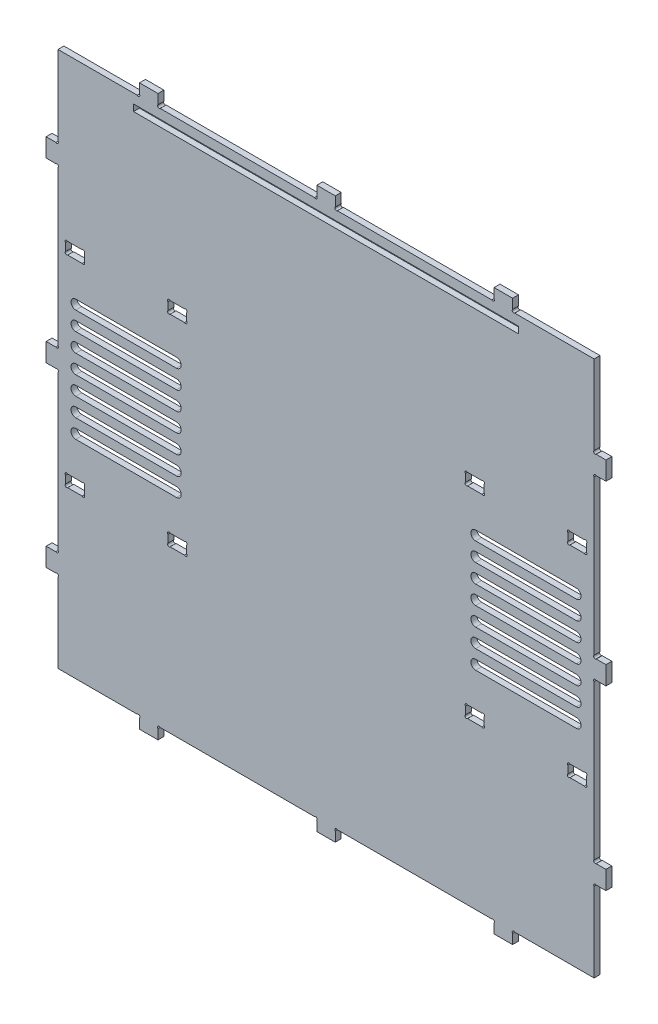
from build123d import *

# Parameters (mm, degrees)
SKETCH15_W                 = 287.299999948
SKETCH15_H                 = 287.299999948
BOSS_EXTRUDE10_DEPTH       = 3.175
SKETCH18_W                 = 206.375
SKETCH18_H                 = 3.556
SLOT_DEPTH                 = 3.175
SKETCH24_W                 = 10.000000066
SKETCH24_H                 = 6.35
TOOTH_DEPTH                = 3.175
TOOTH_DB_D                 = 1.5875
SKETCH62_W                 = 0.0508
SKETCH62_H                 = 5.227478772
TOOTH_TOLR_DEPTH           = 411.830491888
TOOTH_PATTERN_SIDE_DEPTH   = 3.175
TOOTH_PATTERN_SIDE_2_DEPTH = 3.175
TOOTH_PATTERN_FULL_DEPTH   = 3.175
TOOTH_PATTERN_FULL_2_DEPTH = 3.175
CUT_EXTRUDE2_DEPTH         = 6.35
SKETCH66_W                 = 10
SKETCH66_H                 = 6.35
CUT_EXTRUDE14_DEPTH        = 416.295949371
SKETCH67_R                 = 0.79375
CUT_EXTRUDE15_DEPTH        = 416.295949371


# Read off the part's stored shape, not the designer's step: tooth_pattern_side, tooth_pattern_full
with BuildPart() as part:
    # Sketch15 → Boss-Extrude10 (new body)
    with BuildSketch(Plane.XY):
        with Locations((143.649999974, 143.649999974)):
            Rectangle(SKETCH15_W, SKETCH15_H)
    extrude(amount=BOSS_EXTRUDE10_DEPTH)

    # Sketch18 → slot (cut)
    with BuildSketch(Plane.XY.offset(3.175)):
        with Locations((143.649999974, 280.465831498)):
            Rectangle(SKETCH18_W, SKETCH18_H)
    extrude(amount=-SLOT_DEPTH, mode=Mode.SUBTRACT)

    # Sketch24 → tooth (add)
    with BuildSketch(Plane.XY):
        with Locations((143.649999974, 290.474999948)):
            Rectangle(SKETCH24_W, SKETCH24_H)
    extrude(amount=TOOTH_DEPTH)

    # tooth_db (through all)
    with Locations(Plane.XY.offset(3.175)):
        with Locations((138.091199941, 287.858799948), (149.208800007, 287.858799948)):
            Hole(TOOTH_DB_D / 2)

    # Sketch62 → tooth_tolr (cut, through all)
    with BuildSketch(Plane.XY.offset(3.175)):
        with Locations((138.675399941, 291.036260562)):
            Rectangle(SKETCH62_W, SKETCH62_H)
        with Locations((148.624600007, 291.036260562)):
            Rectangle(SKETCH62_W, SKETCH62_H)
    extrude(amount=-TOOTH_TOLR_DEPTH, mode=Mode.SUBTRACT)

    # tooth_pattern_side outline → tooth_pattern_side (cut)
    with BuildSketch(Plane.XY):
        with BuildLine():
            Line((54.772521235, 287.299999948), (53.645078778, 287.299999948))
            ThreePointArc((53.645078778, 287.299999948), (54.208800007, 287.065049947), (54.772521235, 287.299999948))
        make_face()
        with BuildLine():
            ThreePointArc((42.527478713, 287.299999948), (43.091199941, 287.065049947), (43.65492117, 287.299999948))
            Line((43.65492117, 287.299999948), (42.527478713, 287.299999948))
        make_face()
        with BuildLine():
            Line((244.772521235, 287.299999948), (243.645078778, 287.299999948))
            ThreePointArc((243.645078778, 287.299999948), (244.208800007, 287.065049947), (244.772521235, 287.299999948))
        make_face()
        with BuildLine():
            ThreePointArc((232.527478713, 287.299999948), (233.091199941, 287.065049947), (233.65492117, 287.299999948))
            Line((233.65492117, 287.299999948), (232.527478713, 287.299999948))
        make_face()
    extrude(amount=TOOTH_PATTERN_SIDE_DEPTH, mode=Mode.SUBTRACT)

    # tooth_pattern_side 2 outline → tooth_pattern_side 2 (add)
    with BuildSketch(Plane.XY):
        with BuildLine():
            Line((53.599200007, 293.649999948), (43.700799941, 293.649999948))
            Line((43.700799941, 293.649999948), (43.700799941, 288.422521176))
            Line((43.700799941, 288.422521176), (43.649999941, 288.422521176))
            ThreePointArc((43.649999941, 288.422521176), (43.884942314, 287.862279782), (43.65492117, 287.299999948))
            Line((43.65492117, 287.299999948), (53.645078778, 287.299999948))
            ThreePointArc((53.645078778, 287.299999948), (53.415057634, 287.862279782), (53.650000007, 288.422521176))
            Line((53.650000007, 288.422521176), (53.599200007, 288.422521176))
            Line((53.599200007, 288.422521176), (53.599200007, 293.649999948))
        make_face()
        with BuildLine():
            Line((243.599200007, 293.649999948), (233.700799941, 293.649999948))
            Line((233.700799941, 293.649999948), (233.700799941, 288.422521176))
            Line((233.700799941, 288.422521176), (233.649999941, 288.422521176))
            ThreePointArc((233.649999941, 288.422521176), (233.884942314, 287.862279782), (233.65492117, 287.299999948))
            Line((233.65492117, 287.299999948), (243.645078778, 287.299999948))
            ThreePointArc((243.645078778, 287.299999948), (243.415057634, 287.862279782), (243.650000007, 288.422521176))
            Line((243.650000007, 288.422521176), (243.599200007, 288.422521176))
            Line((243.599200007, 288.422521176), (243.599200007, 293.649999948))
        make_face()
    extrude(amount=TOOTH_PATTERN_SIDE_2_DEPTH)

    # tooth_pattern_full outline → tooth_pattern_full (cut)
    with BuildSketch(Plane.XY):
        with BuildLine():
            Line((0, 244.772521235), (0, 243.645078778))
            ThreePointArc((0, 243.645078778), (0.234950001, 244.208800007), (0, 244.772521235))
        make_face()
        with BuildLine():
            Line((0, 233.65492117), (0, 232.527478713))
            ThreePointArc((0, 232.527478713), (0.234950001, 233.091199941), (0, 233.65492117))
        make_face()
        with BuildLine():
            Line((0, 149.772521235), (0, 148.645078778))
            ThreePointArc((0, 148.645078778), (0.234950001, 149.208800007), (0, 149.772521235))
        make_face()
        with BuildLine():
            Line((0, 138.65492117), (0, 137.527478713))
            ThreePointArc((0, 137.527478713), (0.234950001, 138.091199941), (0, 138.65492117))
        make_face()
        with BuildLine():
            Line((0, 54.772521235), (0, 53.645078778))
            ThreePointArc((0, 53.645078778), (0.234950001, 54.208800007), (0, 54.772521235))
        make_face()
        with BuildLine():
            Line((0, 43.65492117), (0, 42.527478713))
            ThreePointArc((0, 42.527478713), (0.234950001, 43.091199941), (0, 43.65492117))
        make_face()
        with BuildLine():
            Line((42.527478713, 0), (43.65492117, 0))
            ThreePointArc((43.65492117, 0), (43.091199941, 0.234950001), (42.527478713, 0))
        make_face()
        with BuildLine():
            Line((53.645078778, 0), (54.772521235, 0))
            ThreePointArc((54.772521235, 0), (54.208800007, 0.234950001), (53.645078778, 0))
        make_face()
        with BuildLine():
            Line((137.527478713, 0), (138.65492117, 0))
            ThreePointArc((138.65492117, 0), (138.091199941, 0.234950001), (137.527478713, 0))
        make_face()
        with BuildLine():
            Line((148.645078778, 0), (149.772521235, 0))
            ThreePointArc((149.772521235, 0), (149.208800007, 0.234950001), (148.645078778, 0))
        make_face()
        with BuildLine():
            Line((232.527478713, 0), (233.65492117, 0))
            ThreePointArc((233.65492117, 0), (233.091199941, 0.234950001), (232.527478713, 0))
        make_face()
        with BuildLine():
            ThreePointArc((287.299999948, 244.772521235), (287.065049947, 244.208800007), (287.299999948, 243.645078778))
            Line((287.299999948, 243.645078778), (287.299999948, 244.772521235))
        make_face()
        with BuildLine():
            ThreePointArc((287.299999948, 233.65492117), (287.065049947, 233.091199941), (287.299999948, 232.527478713))
            Line((287.299999948, 232.527478713), (287.299999948, 233.65492117))
        make_face()
        with BuildLine():
            ThreePointArc((287.299999948, 149.772521235), (287.065049947, 149.208800007), (287.299999948, 148.645078778))
            Line((287.299999948, 148.645078778), (287.299999948, 149.772521235))
        make_face()
        with BuildLine():
            ThreePointArc((287.299999948, 138.65492117), (287.065049947, 138.091199941), (287.299999948, 137.527478713))
            Line((287.299999948, 137.527478713), (287.299999948, 138.65492117))
        make_face()
        with BuildLine():
            ThreePointArc((287.299999948, 54.772521235), (287.065049947, 54.208800007), (287.299999948, 53.645078778))
            Line((287.299999948, 53.645078778), (287.299999948, 54.772521235))
        make_face()
        with BuildLine():
            ThreePointArc((287.299999948, 43.65492117), (287.065049947, 43.091199941), (287.299999948, 42.527478713))
            Line((287.299999948, 42.527478713), (287.299999948, 43.65492117))
        make_face()
        with BuildLine():
            ThreePointArc((244.772521235, 0), (244.208800007, 0.234950001), (243.645078778, 0))
            Line((243.645078778, 0), (244.772521235, 0))
        make_face()
    extrude(amount=TOOTH_PATTERN_FULL_DEPTH, mode=Mode.SUBTRACT)

    # tooth_pattern_full 2 outline → tooth_pattern_full 2 (add)
    with BuildSketch(Plane.XY):
        with BuildLine():
            ThreePointArc((-1.122521228, 233.649999941), (-0.562279834, 233.884942314), (0, 233.65492117))
            Line((0, 233.65492117), (0, 243.645078778))
            ThreePointArc((0, 243.645078778), (-0.562279834, 243.415057634), (-1.122521228, 243.650000007))
            Line((-1.122521228, 243.650000007), (-1.122521228, 243.599200007))
            Line((-1.122521228, 243.599200007), (-6.35, 243.599200007))
            Line((-6.35, 243.599200007), (-6.35, 233.700799941))
            Line((-6.35, 233.700799941), (-1.122521228, 233.700799941))
            Line((-1.122521228, 233.700799941), (-1.122521228, 233.649999941))
        make_face()
        with BuildLine():
            ThreePointArc((-1.122521228, 138.649999941), (-0.562279834, 138.884942314), (0, 138.65492117))
            Line((0, 138.65492117), (0, 148.645078778))
            ThreePointArc((0, 148.645078778), (-0.562279834, 148.415057634), (-1.122521228, 148.650000007))
            Line((-1.122521228, 148.650000007), (-1.122521228, 148.599200007))
            Line((-1.122521228, 148.599200007), (-6.35, 148.599200007))
            Line((-6.35, 148.599200007), (-6.35, 138.700799941))
            Line((-6.35, 138.700799941), (-1.122521228, 138.700799941))
            Line((-1.122521228, 138.700799941), (-1.122521228, 138.649999941))
        make_face()
        with BuildLine():
            ThreePointArc((-1.122521228, 43.649999941), (-0.562279834, 43.884942314), (0, 43.65492117))
            Line((0, 43.65492117), (0, 53.645078778))
            ThreePointArc((0, 53.645078778), (-0.562279834, 53.415057634), (-1.122521228, 53.650000007))
            Line((-1.122521228, 53.650000007), (-1.122521228, 53.599200007))
            Line((-1.122521228, 53.599200007), (-6.35, 53.599200007))
            Line((-6.35, 53.599200007), (-6.35, 43.700799941))
            Line((-6.35, 43.700799941), (-1.122521228, 43.700799941))
            Line((-1.122521228, 43.700799941), (-1.122521228, 43.649999941))
        make_face()
        with BuildLine():
            ThreePointArc((53.650000007, -1.122521228), (53.415057634, -0.562279834), (53.645078778, 0))
            Line((53.645078778, 0), (43.65492117, 0))
            ThreePointArc((43.65492117, 0), (43.884942314, -0.562279834), (43.649999941, -1.122521228))
            Line((43.649999941, -1.122521228), (43.700799941, -1.122521228))
            Line((43.700799941, -1.122521228), (43.700799941, -6.35))
            Line((43.700799941, -6.35), (53.599200007, -6.35))
            Line((53.599200007, -6.35), (53.599200007, -1.122521228))
            Line((53.599200007, -1.122521228), (53.650000007, -1.122521228))
        make_face()
        with BuildLine():
            ThreePointArc((148.650000007, -1.122521228), (148.415057634, -0.562279834), (148.645078778, 0))
            Line((148.645078778, 0), (138.65492117, 0))
            ThreePointArc((138.65492117, 0), (138.884942314, -0.562279834), (138.649999941, -1.122521228))
            Line((138.649999941, -1.122521228), (138.700799941, -1.122521228))
            Line((138.700799941, -1.122521228), (138.700799941, -6.35))
            Line((138.700799941, -6.35), (148.599200007, -6.35))
            Line((148.599200007, -6.35), (148.599200007, -1.122521228))
            Line((148.599200007, -1.122521228), (148.650000007, -1.122521228))
        make_face()
        with BuildLine():
            Line((287.299999948, 243.645078778), (287.299999948, 233.65492117))
            ThreePointArc((287.299999948, 233.65492117), (287.862279782, 233.884942314), (288.422521176, 233.649999941))
            Line((288.422521176, 233.649999941), (288.422521176, 233.700799941))
            Line((288.422521176, 233.700799941), (293.649999948, 233.700799941))
            Line((293.649999948, 233.700799941), (293.649999948, 243.599200007))
            Line((293.649999948, 243.599200007), (288.422521176, 243.599200007))
            Line((288.422521176, 243.599200007), (288.422521176, 243.650000007))
            ThreePointArc((288.422521176, 243.650000007), (287.862279782, 243.415057634), (287.299999948, 243.645078778))
        make_face()
        with BuildLine():
            Line((287.299999948, 148.645078778), (287.299999948, 138.65492117))
            ThreePointArc((287.299999948, 138.65492117), (287.862279782, 138.884942314), (288.422521176, 138.649999941))
            Line((288.422521176, 138.649999941), (288.422521176, 138.700799941))
            Line((288.422521176, 138.700799941), (293.649999948, 138.700799941))
            Line((293.649999948, 138.700799941), (293.649999948, 148.599200007))
            Line((293.649999948, 148.599200007), (288.422521176, 148.599200007))
            Line((288.422521176, 148.599200007), (288.422521176, 148.650000007))
            ThreePointArc((288.422521176, 148.650000007), (287.862279782, 148.415057634), (287.299999948, 148.645078778))
        make_face()
        with BuildLine():
            Line((287.299999948, 53.645078778), (287.299999948, 43.65492117))
            ThreePointArc((287.299999948, 43.65492117), (287.862279782, 43.884942314), (288.422521176, 43.649999941))
            Line((288.422521176, 43.649999941), (288.422521176, 43.700799941))
            Line((288.422521176, 43.700799941), (293.649999948, 43.700799941))
            Line((293.649999948, 43.700799941), (293.649999948, 53.599200007))
            Line((293.649999948, 53.599200007), (288.422521176, 53.599200007))
            Line((288.422521176, 53.599200007), (288.422521176, 53.650000007))
            ThreePointArc((288.422521176, 53.650000007), (287.862279782, 53.415057634), (287.299999948, 53.645078778))
        make_face()
        with BuildLine():
            Line((233.700799941, -1.122521228), (233.700799941, -6.35))
            Line((233.700799941, -6.35), (243.599200007, -6.35))
            Line((243.599200007, -6.35), (243.599200007, -1.122521228))
            Line((243.599200007, -1.122521228), (243.650000007, -1.122521228))
            ThreePointArc((243.650000007, -1.122521228), (243.415057634, -0.562279834), (243.645078778, 0))
            Line((243.645078778, 0), (233.65492117, 0))
            ThreePointArc((233.65492117, 0), (233.884942314, -0.562279834), (233.649999941, -1.122521228))
            Line((233.649999941, -1.122521228), (233.700799941, -1.122521228))
        make_face()
    extrude(amount=TOOTH_PATTERN_FULL_2_DEPTH)

    # Sketch36 → Cut-Extrude2 (cut)
    with BuildSketch(Plane.XY.offset(3.175)):
        with BuildLine():
            Line((277.774999948, 176.189999974), (223.799999948, 176.189999974))
            ThreePointArc((223.799999948, 176.189999974), (221.259999948, 173.649999974), (223.799999948, 171.109999974))
            Line((223.799999948, 171.109999974), (277.774999948, 171.109999974))
            ThreePointArc((277.774999948, 171.109999974), (280.314999948, 173.649999974), (277.774999948, 176.189999974))
        make_face()
        with BuildLine():
            Line((277.774999948, 166.189999974), (223.799999948, 166.189999974))
            ThreePointArc((223.799999948, 166.189999974), (221.259999948, 163.649999974), (223.799999948, 161.109999974))
            Line((223.799999948, 161.109999974), (277.774999948, 161.109999974))
            ThreePointArc((277.774999948, 161.109999974), (280.314999948, 163.649999974), (277.774999948, 166.189999974))
        make_face()
        with BuildLine():
            Line((9.525, 176.189999974), (63.5, 176.189999974))
            ThreePointArc((63.5, 176.189999974), (66.04, 173.649999974), (63.5, 171.109999974))
            Line((63.5, 171.109999974), (9.525, 171.109999974))
            ThreePointArc((9.525, 171.109999974), (6.985, 173.649999974), (9.525, 176.189999974))
        make_face()
        with BuildLine():
            Line((277.774999948, 156.189999974), (223.799999948, 156.189999974))
            ThreePointArc((223.799999948, 156.189999974), (221.259999948, 153.649999974), (223.799999948, 151.109999974))
            Line((223.799999948, 151.109999974), (277.774999948, 151.109999974))
            ThreePointArc((277.774999948, 151.109999974), (280.314999948, 153.649999974), (277.774999948, 156.189999974))
        make_face()
        with BuildLine():
            Line((9.525, 166.189999974), (63.5, 166.189999974))
            ThreePointArc((63.5, 166.189999974), (66.04, 163.649999974), (63.5, 161.109999974))
            Line((63.5, 161.109999974), (9.525, 161.109999974))
            ThreePointArc((9.525, 161.109999974), (6.985, 163.649999974), (9.525, 166.189999974))
        make_face()
        with BuildLine():
            Line((9.525, 156.189999974), (63.5, 156.189999974))
            ThreePointArc((63.5, 156.189999974), (66.04, 153.649999974), (63.5, 151.109999974))
            Line((63.5, 151.109999974), (9.525, 151.109999974))
            ThreePointArc((9.525, 151.109999974), (6.985, 153.649999974), (9.525, 156.189999974))
        make_face()
        with BuildLine():
            Line((9.525, 146.189999974), (63.5, 146.189999974))
            ThreePointArc((63.5, 146.189999974), (66.04, 143.649999974), (63.5, 141.109999974))
            Line((63.5, 141.109999974), (9.525, 141.109999974))
            ThreePointArc((9.525, 141.109999974), (6.985, 143.649999974), (9.525, 146.189999974))
        make_face()
        with BuildLine():
            Line((9.525, 136.189999974), (63.5, 136.189999974))
            ThreePointArc((63.5, 136.189999974), (66.04, 133.649999974), (63.5, 131.109999974))
            Line((63.5, 131.109999974), (9.525, 131.109999974))
            ThreePointArc((9.525, 131.109999974), (6.985, 133.649999974), (9.525, 136.189999974))
        make_face()
        with BuildLine():
            Line((9.525, 126.189999974), (63.5, 126.189999974))
            ThreePointArc((63.5, 126.189999974), (66.04, 123.649999974), (63.5, 121.109999974))
            Line((63.5, 121.109999974), (9.525, 121.109999974))
            ThreePointArc((9.525, 121.109999974), (6.985, 123.649999974), (9.525, 126.189999974))
        make_face()
        with BuildLine():
            Line((9.525, 116.189999974), (63.5, 116.189999974))
            ThreePointArc((63.5, 116.189999974), (66.04, 113.649999974), (63.5, 111.109999974))
            Line((63.5, 111.109999974), (9.525, 111.109999974))
            ThreePointArc((9.525, 111.109999974), (6.985, 113.649999974), (9.525, 116.189999974))
        make_face()
        with BuildLine():
            Line((277.774999948, 146.189999974), (223.799999948, 146.189999974))
            ThreePointArc((223.799999948, 146.189999974), (221.259999948, 143.649999974), (223.799999948, 141.109999974))
            Line((223.799999948, 141.109999974), (277.774999948, 141.109999974))
            ThreePointArc((277.774999948, 141.109999974), (280.314999948, 143.649999974), (277.774999948, 146.189999974))
        make_face()
        with BuildLine():
            Line((277.774999948, 136.189999974), (223.799999948, 136.189999974))
            ThreePointArc((223.799999948, 136.189999974), (221.259999948, 133.649999974), (223.799999948, 131.109999974))
            Line((223.799999948, 131.109999974), (277.774999948, 131.109999974))
            ThreePointArc((277.774999948, 131.109999974), (280.314999948, 133.649999974), (277.774999948, 136.189999974))
        make_face()
        with BuildLine():
            Line((277.774999948, 126.189999974), (223.799999948, 126.189999974))
            ThreePointArc((223.799999948, 126.189999974), (221.259999948, 123.649999974), (223.799999948, 121.109999974))
            Line((223.799999948, 121.109999974), (277.774999948, 121.109999974))
            ThreePointArc((277.774999948, 121.109999974), (280.314999948, 123.649999974), (277.774999948, 126.189999974))
        make_face()
        with BuildLine():
            Line((277.774999948, 116.189999974), (223.799999948, 116.189999974))
            ThreePointArc((223.799999948, 116.189999974), (221.259999948, 113.649999974), (223.799999948, 111.109999974))
            Line((223.799999948, 111.109999974), (277.774999948, 111.109999974))
            ThreePointArc((277.774999948, 111.109999974), (280.314999948, 113.649999974), (277.774999948, 116.189999974))
        make_face()
    extrude(amount=-CUT_EXTRUDE2_DEPTH, mode=Mode.SUBTRACT)

    # Sketch66 → Cut-Extrude14 (cut, through all)
    with BuildSketch(Plane(origin=(0, 0, 0), x_dir=(-1, 0, 0), z_dir=(0, 0, -1))):
        with Locations((-278.219499948, 197.624999974)):
            Rectangle(SKETCH66_W, SKETCH66_H)
    cut_extrude14 = extrude(amount=-CUT_EXTRUDE14_DEPTH, mode=Mode.SUBTRACT)

    # Sketch67 → Cut-Extrude15 (cut, through all)
    with BuildSketch(Plane(origin=(0, 0, 0), x_dir=(-1, 0, 0), z_dir=(0, 0, -1))):
        with Locations((-282.65823394, 200.238733966)):
            Circle(SKETCH67_R)
        with Locations((-282.65823394, 195.011265982)):
            Circle(SKETCH67_R)
        with Locations((-273.780765956, 195.011265982)):
            Circle(SKETCH67_R)
        with Locations((-273.780765956, 200.238733966)):
            Circle(SKETCH67_R)
    cut_extrude15 = extrude(amount=-CUT_EXTRUDE15_DEPTH, mode=Mode.SUBTRACT)

    # Sketch-Pattern3: Cut-Extrude14, Cut-Extrude15 at 7 more places
    with Locations((-54.864, 0, 0), (-54.864, -107.95, 0), (0, -107.95, 0), (-269.139, 0, 0), (-269.139, -107.95, 0), (-214.275, 0, 0), (-214.275, -107.95, 0)):
        add(cut_extrude14, mode=Mode.SUBTRACT)
        add(cut_extrude15, mode=Mode.SUBTRACT)


solid = part.part
